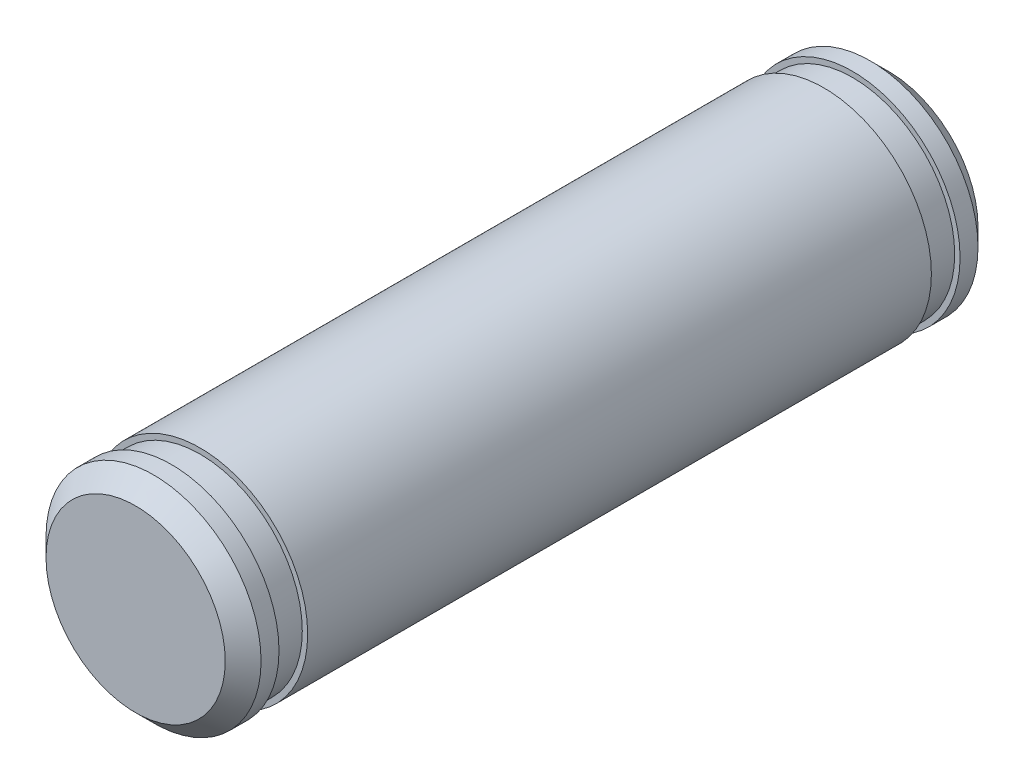
from build123d import *

# Parameters (mm, degrees)
SZKIC1_R                    = 3
DODANIE_WYCI_GNI_CIE1_DEPTH = 21
SFAZOWANIE1_SIZE            = 0.5
WYTNIJ_WYCI_GNI_CIE1_START  = -1.8
SZKIC2_R                    = 3
SZKIC2_R_2                  = 2.85
WYTNIJ_WYCI_GNI_CIE1_DEPTH  = 0.8
WYTNIJ_WYCI_GNI_CIE2_START  = -1
SZKIC3_R                    = 3
SZKIC3_R_2                  = 2.85
WYTNIJ_WYCI_GNI_CIE2_DEPTH  = 0.8


with BuildPart() as part:
    # Szkic1 → Dodanie-wyciągnięcie1 (new body)
    with BuildSketch(Plane.XY):
        Circle(SZKIC1_R)
    extrude(amount=DODANIE_WYCI_GNI_CIE1_DEPTH)

    # Sfazowanie1
    sfazowanie1_edges = [part.edges().sort_by_distance(p)[0] for p in [
        (-3, 0, 0),
        (-3, 0, 21),
    ]]
    chamfer(sfazowanie1_edges, length=SFAZOWANIE1_SIZE)

    # Szkic2 → Wytnij-wyciągnięcie1 (cut)
    with BuildSketch(Plane.XY.offset(21).offset(WYTNIJ_WYCI_GNI_CIE1_START)):
        Circle(SZKIC2_R)
        Circle(SZKIC2_R_2, mode=Mode.SUBTRACT)
    extrude(amount=WYTNIJ_WYCI_GNI_CIE1_DEPTH, mode=Mode.SUBTRACT)

    # Szkic3 → Wytnij-wyciągnięcie2 (cut)
    with BuildSketch(Plane(origin=(0, 0, 0), x_dir=(-1, 0, 0), z_dir=(0, 0, -1)).offset(WYTNIJ_WYCI_GNI_CIE2_START)):
        Circle(SZKIC3_R)
        Circle(SZKIC3_R_2, mode=Mode.SUBTRACT)
    extrude(amount=-WYTNIJ_WYCI_GNI_CIE2_DEPTH, mode=Mode.SUBTRACT)


solid = part.part
